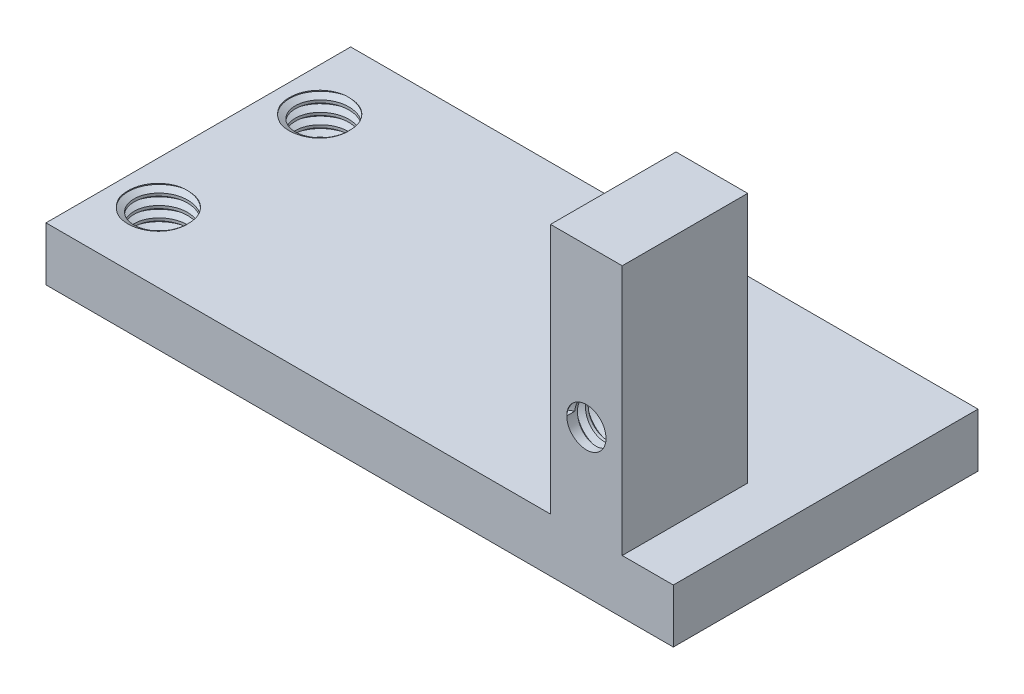
from build123d import *
from build123d.topology import SkipClean

# Parameters (mm, degrees)
BOSS_EXTRUDE1_DEPTH = 3
SKETCH3_R           = 1.5
CUT_EXTRUDE1_DEPTH  = 6
SKETCH4_W           = 4
SKETCH4_H           = 7
BOSS_EXTRUDE2_DEPTH = 14
SKETCH5_R           = 1.095413363
CUT_EXTRUDE2_DEPTH  = 5
THREAD1_PITCH       = 0.6
THREAD2_PITCH       = 0.6
THREAD3_PITCH       = 0.6


with BuildPart() as part:
    # Sketch1 → Boss-Extrude1 (new body)
    with BuildSketch(Plane(origin=(0, 0, 0), x_dir=(1, 0, 0), z_dir=(0, 1, 0))):
        Polygon((-102.400428266, -124.685224839), (-72.400428266, -124.685224839), (-72.400428266, -141.685224839), (-95.400428266, -141.685224839), (-107.400428266, -141.685224839), (-107.400428266, -124.685224839), align=None)
    extrude(amount=BOSS_EXTRUDE1_DEPTH)

    # Sketch3 → Cut-Extrude1 (cut)
    with BuildSketch(Plane.XZ):
        with Locations(Location((-104.900428266, 128.685224839, 0), (0, 0, 270))):
            Circle(SKETCH3_R)
        with Locations(Location((-104.900428266, 137.685224839, 0), (0, 0, 270))):
            Circle(SKETCH3_R)
    extrude(amount=-CUT_EXTRUDE1_DEPTH, mode=Mode.SUBTRACT)

    # Sketch4 → Boss-Extrude2 (add)
    with BuildSketch(Plane(origin=(0, 3, 0), x_dir=(1, 0, 0), z_dir=(0, 1, 0))):
        with Locations((-77.250322101, -138.185224839)):
            Rectangle(SKETCH4_W, SKETCH4_H)
    extrude(amount=BOSS_EXTRUDE2_DEPTH)

    # Sketch5 → Cut-Extrude2 (cut)
    with BuildSketch(Plane.XY.offset(141.685224839)):
        with Locations((-77.250428266, 8.2)):
            Circle(SKETCH5_R)
    extrude(amount=-CUT_EXTRUDE2_DEPTH, mode=Mode.SUBTRACT)

    # Thread1: the profile of Thread Profile1 profile screwed along a right-hand helix of 16.666667 turns, 6 arcs to a turn; built about Z, then put on its axis
    with SkipClean():  # the faces are left unmerged after this step: merging them gives an invalid solid
        thread1_z = Axis((0, 0, 0), (0, 0, 1))
        thread1_corners = [(1.4997, 0, -0.000173205), (1.824759525, 0, 0.187499999), (1.824759525, 0, 0.262499999), (1.4997, 0, 0.450173203)]
        with BuildLine(mode=Mode.PRIVATE) as thread1_profile:
            Line(thread1_corners[0], thread1_corners[1])
            Line(thread1_corners[1], thread1_corners[2])
            Line(thread1_corners[2], thread1_corners[3])
            Line(thread1_corners[3], thread1_corners[0])
        thread1_cap = Face(thread1_profile.wire())
        thread1_turn_angles = [0, 30, 60, 90, 120, 150, 180, 210, 240, 270, 300, 330, 360]
        thread1_turn_weights = [1, 0.8660254037844387, 1, 0.8660254037844387, 1, 0.8660254037844387, 1, 0.8660254037844387, 1, 0.8660254037844387, 1, 0.8660254037844387, 1]
        thread1_turn_rails = [Edge.make_bspline([Vector(p[0], p[1], 0).rotate(thread1_z, thread1_turn_angles[k]) / thread1_turn_weights[k] + Vector(0, 0, p[2] + THREAD1_PITCH * thread1_turn_angles[k] / 360) for k in range(13)], [0, 0, 0, 1, 1, 2, 2, 3, 3, 4, 4, 5, 5, 6, 6, 6], 2, thread1_turn_weights) for p in thread1_corners]
        thread1_turn_sides = [Face.make_surface_from_curves(thread1_turn_rails[p[0]], thread1_turn_rails[p[1]]) for p in [(0, 1), (1, 2), (2, 3), (3, 0)]]
        thread1_last_angles = [5760, 5790, 5820, 5850, 5880, 5910, 5940, 5970, 6000]
        thread1_last_weights = [1, 0.8660254037844387, 1, 0.8660254037844387, 1, 0.8660254037844387, 1, 0.8660254037844387, 1]
        thread1_last_rails = [Edge.make_bspline([Vector(p[0], p[1], 0).rotate(thread1_z, thread1_last_angles[k]) / thread1_last_weights[k] + Vector(0, 0, p[2] + THREAD1_PITCH * thread1_last_angles[k] / 360) for k in range(9)], [0, 0, 0, 1, 1, 2, 2, 3, 3, 4, 4, 4], 2, thread1_last_weights) for p in thread1_corners]
        thread1_last_sides = [Face.make_surface_from_curves(thread1_last_rails[p[0]], thread1_last_rails[p[1]]) for p in [(0, 1), (1, 2), (2, 3), (3, 0)]]
        thread1 = Plane(origin=(-104.900428266, 0, 137.685224839), x_dir=(1, 0, 0), z_dir=(0, 1, 0)) * Solid(Shell([*[p.moved(Location((0, 0, THREAD1_PITCH * i))) for i in range(16) for p in thread1_turn_sides], *thread1_last_sides, thread1_cap, thread1_cap.rotate(thread1_z, 6000).moved(Location((0, 0, THREAD1_PITCH * 6000 / 360)))]))
        add(thread1, mode=Mode.SUBTRACT)

    # Thread2: the profile of Thread Profile2 profile screwed along a right-hand helix of 16.666667 turns, 6 arcs to a turn; built about Z, then put on its axis
    with SkipClean():  # the faces are left unmerged after this step: merging them gives an invalid solid
        thread2_z = Axis((0, 0, 0), (0, 0, 1))
        thread2_corners = [(1.4997, 0, -0.000173205), (1.824759525, 0, 0.187499999), (1.824759525, 0, 0.262499999), (1.4997, 0, 0.450173203)]
        with BuildLine(mode=Mode.PRIVATE) as thread2_profile:
            Line(thread2_corners[0], thread2_corners[1])
            Line(thread2_corners[1], thread2_corners[2])
            Line(thread2_corners[2], thread2_corners[3])
            Line(thread2_corners[3], thread2_corners[0])
        thread2_cap = Face(thread2_profile.wire())
        thread2_turn_angles = [0, 30, 60, 90, 120, 150, 180, 210, 240, 270, 300, 330, 360]
        thread2_turn_weights = [1, 0.8660254037844387, 1, 0.8660254037844387, 1, 0.8660254037844387, 1, 0.8660254037844387, 1, 0.8660254037844387, 1, 0.8660254037844387, 1]
        thread2_turn_rails = [Edge.make_bspline([Vector(p[0], p[1], 0).rotate(thread2_z, thread2_turn_angles[k]) / thread2_turn_weights[k] + Vector(0, 0, p[2] + THREAD2_PITCH * thread2_turn_angles[k] / 360) for k in range(13)], [0, 0, 0, 1, 1, 2, 2, 3, 3, 4, 4, 5, 5, 6, 6, 6], 2, thread2_turn_weights) for p in thread2_corners]
        thread2_turn_sides = [Face.make_surface_from_curves(thread2_turn_rails[p[0]], thread2_turn_rails[p[1]]) for p in [(0, 1), (1, 2), (2, 3), (3, 0)]]
        thread2_last_angles = [5760, 5790, 5820, 5850, 5880, 5910, 5940, 5970, 6000]
        thread2_last_weights = [1, 0.8660254037844387, 1, 0.8660254037844387, 1, 0.8660254037844387, 1, 0.8660254037844387, 1]
        thread2_last_rails = [Edge.make_bspline([Vector(p[0], p[1], 0).rotate(thread2_z, thread2_last_angles[k]) / thread2_last_weights[k] + Vector(0, 0, p[2] + THREAD2_PITCH * thread2_last_angles[k] / 360) for k in range(9)], [0, 0, 0, 1, 1, 2, 2, 3, 3, 4, 4, 4], 2, thread2_last_weights) for p in thread2_corners]
        thread2_last_sides = [Face.make_surface_from_curves(thread2_last_rails[p[0]], thread2_last_rails[p[1]]) for p in [(0, 1), (1, 2), (2, 3), (3, 0)]]
        thread2 = Plane(origin=(-104.900428266, 0, 128.685224839), x_dir=(1, 0, 0), z_dir=(0, 1, 0)) * Solid(Shell([*[p.moved(Location((0, 0, THREAD2_PITCH * i))) for i in range(16) for p in thread2_turn_sides], *thread2_last_sides, thread2_cap, thread2_cap.rotate(thread2_z, 6000).moved(Location((0, 0, THREAD2_PITCH * 6000 / 360)))]))
        add(thread2, mode=Mode.SUBTRACT)

    # Thread3: the profile of Thread Profile3 profile screwed along a right-hand helix of 8.333333 turns, 6 arcs to a turn; built about Z, then put on its axis
    with SkipClean():  # the faces are left unmerged after this step: merging them gives an invalid solid
        thread3_z = Axis((0, 0, 0), (0, 0, 1))
        thread3_corners = [(1.095113363, 0, -0.000173205), (1.420172888, 0, 0.187499999), (1.420172888, 0, 0.262499999), (1.095113363, 0, 0.450173203)]
        with BuildLine(mode=Mode.PRIVATE) as thread3_profile:
            Line(thread3_corners[0], thread3_corners[1])
            Line(thread3_corners[1], thread3_corners[2])
            Line(thread3_corners[2], thread3_corners[3])
            Line(thread3_corners[3], thread3_corners[0])
        thread3_cap = Face(thread3_profile.wire())
        thread3_turn_angles = [0, 30, 60, 90, 120, 150, 180, 210, 240, 270, 300, 330, 360]
        thread3_turn_weights = [1, 0.8660254037844387, 1, 0.8660254037844387, 1, 0.8660254037844387, 1, 0.8660254037844387, 1, 0.8660254037844387, 1, 0.8660254037844387, 1]
        thread3_turn_rails = [Edge.make_bspline([Vector(p[0], p[1], 0).rotate(thread3_z, thread3_turn_angles[k]) / thread3_turn_weights[k] + Vector(0, 0, p[2] + THREAD3_PITCH * thread3_turn_angles[k] / 360) for k in range(13)], [0, 0, 0, 1, 1, 2, 2, 3, 3, 4, 4, 5, 5, 6, 6, 6], 2, thread3_turn_weights) for p in thread3_corners]
        thread3_turn_sides = [Face.make_surface_from_curves(thread3_turn_rails[p[0]], thread3_turn_rails[p[1]]) for p in [(0, 1), (1, 2), (2, 3), (3, 0)]]
        thread3_last_angles = [2880, 2910, 2940, 2970, 3000]
        thread3_last_weights = [1, 0.8660254037844387, 1, 0.8660254037844387, 1]
        thread3_last_rails = [Edge.make_bspline([Vector(p[0], p[1], 0).rotate(thread3_z, thread3_last_angles[k]) / thread3_last_weights[k] + Vector(0, 0, p[2] + THREAD3_PITCH * thread3_last_angles[k] / 360) for k in range(5)], [0, 0, 0, 1, 1, 2, 2, 2], 2, thread3_last_weights) for p in thread3_corners]
        thread3_last_sides = [Face.make_surface_from_curves(thread3_last_rails[p[0]], thread3_last_rails[p[1]]) for p in [(0, 1), (1, 2), (2, 3), (3, 0)]]
        thread3 = Plane(origin=(-77.250428266, 8.2, 141.685224839), x_dir=(-1, 0, 0), z_dir=(0, 0, -1)) * Solid(Shell([*[p.moved(Location((0, 0, THREAD3_PITCH * i))) for i in range(8) for p in thread3_turn_sides], *thread3_last_sides, thread3_cap, thread3_cap.rotate(thread3_z, 3000).moved(Location((0, 0, THREAD3_PITCH * 3000 / 360)))]))
        add(thread3, mode=Mode.SUBTRACT)


solid = part.part
